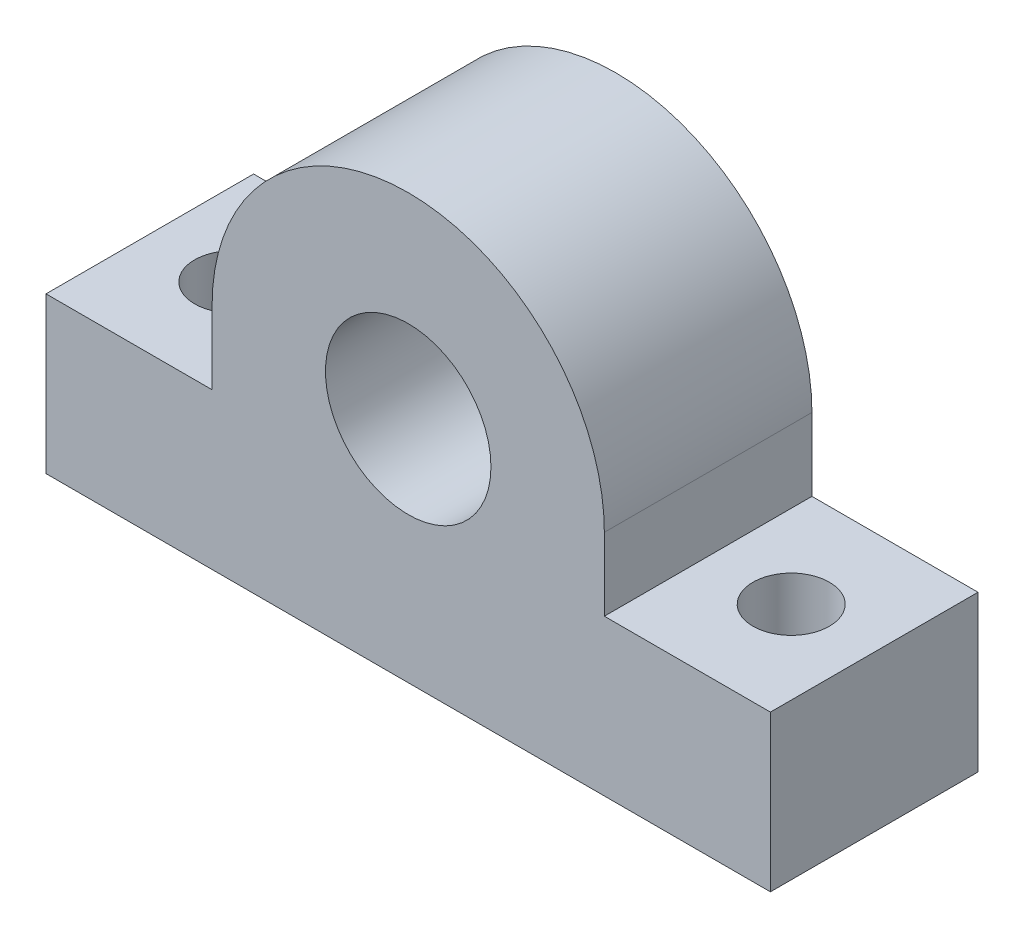
from build123d import *

# Parameters (mm, degrees)
SKETCH1_R           = 2.53125
BOSS_EXTRUDE1_DEPTH = 6.35
SKETCH2_R           = 1.1684
CUT_EXTRUDE1_DEPTH  = 6.35


with BuildPart() as part:
    # Sketch1 → Boss-Extrude1 (new body)
    with BuildSketch(Plane.XY):
        with BuildLine():
            Line((-6, 0), (-6, -2.2225))
            Line((-6, -2.2225), (-11.08, -2.2225))
            Line((-11.08, -2.2225), (-11.08, -6.985))
            Line((-11.08, -6.985), (11.08, -6.985))
            Line((11.08, -6.985), (11.08, -2.2225))
            Line((11.08, -2.2225), (6, -2.2225))
            Line((6, -2.2225), (6, 0))
            ThreePointArc((6, 0), (0, 6), (-6, 0))
        make_face()
        Circle(SKETCH1_R, mode=Mode.SUBTRACT)
    extrude(amount=BOSS_EXTRUDE1_DEPTH)

    # Sketch2 → Cut-Extrude1 (cut)
    with BuildSketch(Plane(origin=(0, -2.2225, 0), x_dir=(1, 0, 0), z_dir=(0, 1, 0))):
        with Locations((-8.54, -3.175)):
            Circle(SKETCH2_R)
        with Locations((8.54, -3.175)):
            Circle(SKETCH2_R)
    extrude(amount=-CUT_EXTRUDE1_DEPTH, mode=Mode.SUBTRACT)


solid = part.part
